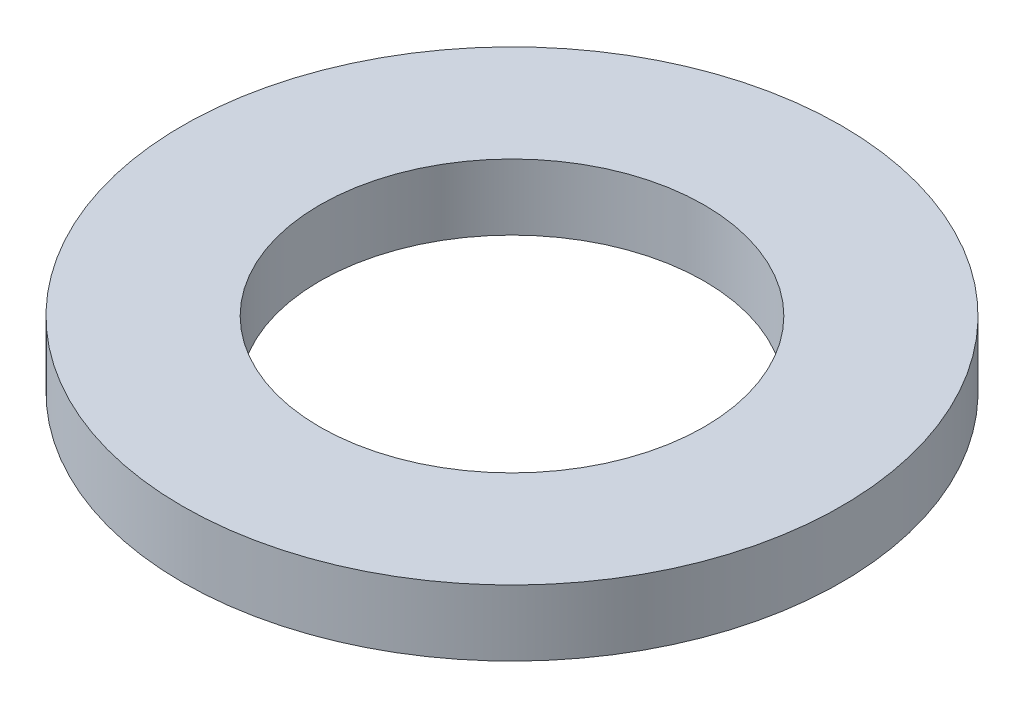
from build123d import *

# Parameters (mm, degrees)
SKETCH1_R           = 60
BOSS_EXTRUDE1_DEPTH = 12
SKETCH2_R           = 35
CUT_EXTRUDE1_DEPTH  = 86.697141143


with BuildPart() as part:
    # Sketch1 → Boss-Extrude1 (new body)
    with BuildSketch(Plane(origin=(0, 0, 0), x_dir=(1, 0, 0), z_dir=(0, 1, 0))):
        Circle(SKETCH1_R)
    extrude(amount=BOSS_EXTRUDE1_DEPTH)

    # Sketch2 → Cut-Extrude1 (cut, through all)
    with BuildSketch(Plane(origin=(0, 0, 0), x_dir=(1, 0, 0), z_dir=(0, 1, 0))):
        Circle(SKETCH2_R)
    extrude(amount=CUT_EXTRUDE1_DEPTH, mode=Mode.SUBTRACT)


solid = part.part
